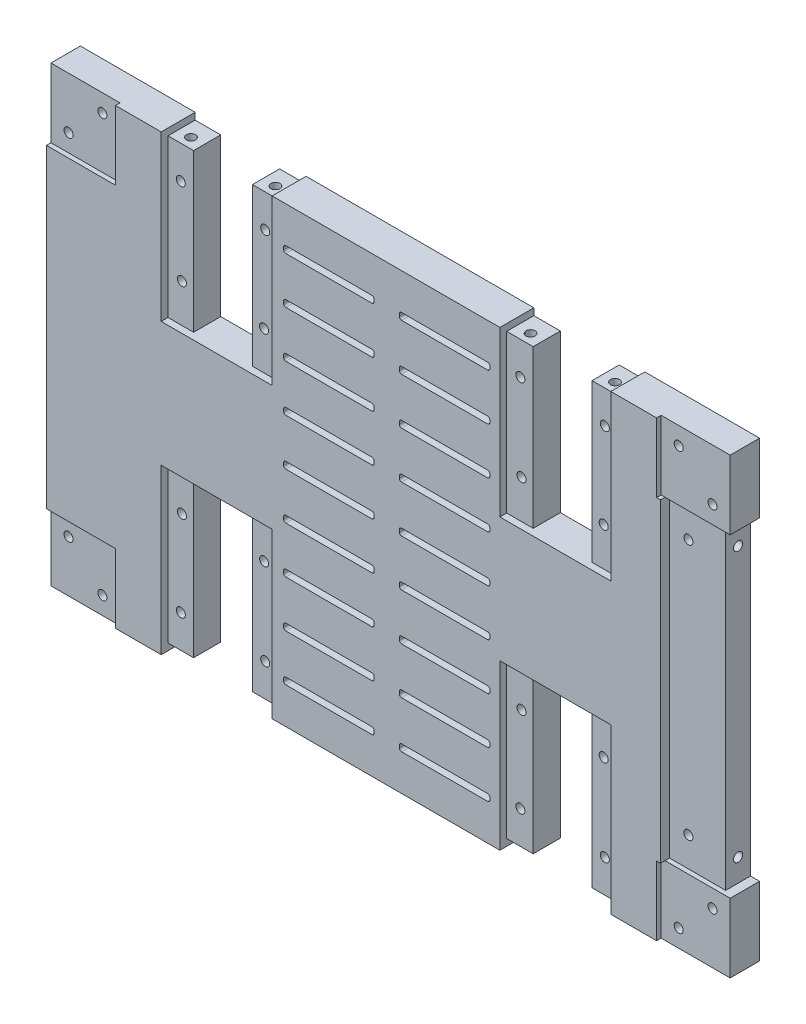
from build123d import *

# Parameters (mm, degrees)
CROQUIS1_W               = 300
CROQUIS1_H               = 200
SALIENTE_EXTRUIR1_DEPTH  = 15
CROQUIS2_W               = 30.5
CROQUIS2_H               = 30.5
HUECOS_COLUMNA_DEPTH     = 2
HUECOS_MOTOR_DEPTH       = 181.900525151
CROQUIS4_R               = 2
SIDE_SCREWS_1_DEPTH      = 15
SIDE_START               = -15
CROQUIS5_R               = 2
SIDE_SCREWS_2_DEPTH      = 15
CROQUIS7_R               = 2
SCREWS_AND_VENTI_DEPTH   = 15
CROQUIS9_W               = 49
CROQUIS9_H               = 69.5
CORTAR_EXTRUIR6_DEPTH    = 3
CROQUIS13_W              = 15
CROQUIS13_H              = 139
CORTAR_EXTRUIR9_DEPTH    = 4
CROQUIS14_W              = 24.78
CROQUIS14_H              = 139
CORTAR_EXTRUIR10_DEPTH   = 4
CROQUIS15_R              = 2
CORTAR_EXTRUIR11_DEPTH   = 4
CROQUIS16_R              = 2
SIDE_SCREWS_UPDOWN_DEPTH = 10


with BuildPart() as part:
    # Croquis1 → Saliente-Extruir1 (new body)
    with BuildSketch(Plane.XY):
        Rectangle(CROQUIS1_W, CROQUIS1_H)
    extrude(amount=SALIENTE_EXTRUIR1_DEPTH)

    # Croquis2 → Huecos columna (cut)
    with BuildSketch(Plane.XY.offset(15)):
        with Locations((-134.75, 84.75)):
            Rectangle(CROQUIS2_W, CROQUIS2_H)
        with Locations((134.75, 84.75)):
            Rectangle(CROQUIS2_W, CROQUIS2_H)
        with Locations((134.75, -84.75)):
            Rectangle(CROQUIS2_W, CROQUIS2_H)
        with Locations((-134.75, -84.75)):
            Rectangle(CROQUIS2_W, CROQUIS2_H)
    extrude(amount=-HUECOS_COLUMNA_DEPTH, mode=Mode.SUBTRACT)

    # Croquis3 → huecos motor (cut, through all)
    with BuildSketch(Plane.XY.offset(15)):
        Polygon((-88, -97), (-88, -27.5), (-62, -27.5), (-62, -97), (-50.295392228, -97), (-50.295392228, -100), (-99.295392228, -100), (-99.295392228, -97), align=None)
        Polygon((88, -27.5), (62, -27.5), (62, -97), (50.295392228, -97), (50.295392228, -100), (99.295392228, -100), (99.295392228, -97), (88, -97), align=None)
        Polygon((88, 97), (88, 27.5), (62, 27.5), (62, 97), (50.295392228, 97), (50.295392228, 100), (99.295392228, 100), (99.295392228, 97), align=None)
        Polygon((-88, 27.5), (-62, 27.5), (-62, 97), (-50.295392228, 97), (-50.295392228, 100), (-99.295392228, 100), (-99.295392228, 97), (-88, 97), align=None)
    extrude(amount=-HUECOS_MOTOR_DEPTH, mode=Mode.SUBTRACT)

    # Croquis4 → side_screws 1 (cut)
    with BuildSketch(Plane.XZ.offset(97)):
        with Locations((-93.647696114, 7.5)):
            Circle(CROQUIS4_R)
        with Locations((-56.352303886, 7.5)):
            Circle(CROQUIS4_R)
        with Locations((56.352303886, 7.5)):
            Circle(CROQUIS4_R)
        with Locations((93.647696114, 7.5)):
            Circle(CROQUIS4_R)
    extrude(amount=-SIDE_SCREWS_1_DEPTH, mode=Mode.SUBTRACT)

    # Croquis5 → side screws 2 (cut)
    with BuildSketch(Plane(origin=(0, 97, 0), x_dir=(1, 0, 0), z_dir=(0, 1, 0)).offset(SIDE_START)):
        with Locations((-93.647696114, -7.5)):
            Circle(CROQUIS5_R)
        with Locations((-56.352303886, -7.5)):
            Circle(CROQUIS5_R)
        with Locations((56.352303886, -7.5)):
            Circle(CROQUIS5_R)
        with Locations((93.647696114, -7.5)):
            Circle(CROQUIS5_R)
    extrude(amount=SIDE_SCREWS_2_DEPTH, mode=Mode.SUBTRACT)

    # Croquis7 → screws and venti (cut)
    with BuildSketch(Plane.XY.offset(15)):
        with Locations((-127.278174593, -92.221825407)):
            Circle(CROQUIS7_R)
        with Locations((-142.221825407, -77.278174593)):
            Circle(CROQUIS7_R)
        with Locations((-127.278174593, 92.221825407)):
            Circle(CROQUIS7_R)
        with Locations((-142.221825407, 77.278174593)):
            Circle(CROQUIS7_R)
        with Locations((127.278174593, -92.221825407)):
            Circle(CROQUIS7_R)
        with Locations((142.221825407, -77.278174593)):
            Circle(CROQUIS7_R)
        with Locations((127.278174593, 92.221825407)):
            Circle(CROQUIS7_R)
        with Locations((142.221825407, 77.278174593)):
            Circle(CROQUIS7_R)
        with Locations((-93.647696114, -82.5)):
            Circle(CROQUIS7_R)
        with Locations((-93.147733982, -44.503289118)):
            Circle(CROQUIS7_R)
        with Locations((-56.352303886, -82.5)):
            Circle(CROQUIS7_R)
        with Locations((-56.852266018, -44.503289118)):
            Circle(CROQUIS7_R)
        with Locations((56.852266018, -44.503289118)):
            Circle(CROQUIS7_R)
        with Locations((56.352303886, -82.5)):
            Circle(CROQUIS7_R)
        with Locations((93.647696114, -82.5)):
            Circle(CROQUIS7_R)
        with Locations((93.147733982, -44.503289118)):
            Circle(CROQUIS7_R)
        with Locations((93.647696114, 82.5)):
            Circle(CROQUIS7_R)
        with Locations((93.147733982, 44.503289118)):
            Circle(CROQUIS7_R)
        with Locations((56.352303886, 82.5)):
            Circle(CROQUIS7_R)
        with Locations((56.852266018, 44.503289118)):
            Circle(CROQUIS7_R)
        with Locations((-56.352303886, 82.5)):
            Circle(CROQUIS7_R)
        with Locations((-56.852266018, 44.503289118)):
            Circle(CROQUIS7_R)
        with Locations((-93.647696114, 82.5)):
            Circle(CROQUIS7_R)
        with Locations((-93.147733982, 44.503289118)):
            Circle(CROQUIS7_R)
        with BuildLine():
            Line((6.875948392, 84), (44.875948392, 84))
            ThreePointArc((44.875948392, 84), (45.583055173, 83.707106781), (45.875948392, 83))
            Line((45.875948392, 83), (45.875948392, 82))
            ThreePointArc((45.875948392, 82), (45.583055173, 81.292893219), (44.875948392, 81))
            Line((44.875948392, 81), (6.875948392, 81))
            ThreePointArc((6.875948392, 81), (6.168841611, 81.292893219), (5.875948392, 82))
            Line((5.875948392, 82), (5.875948392, 83))
            ThreePointArc((5.875948392, 83), (6.168841611, 83.707106781), (6.875948392, 84))
        make_face()
        with BuildLine():
            Line((-44.236036181, 81), (-6.236036181, 81))
            ThreePointArc((-6.236036181, 81), (-5.5289294, 81.292893219), (-5.236036181, 82))
            Line((-5.236036181, 82), (-5.236036181, 83))
            ThreePointArc((-5.236036181, 83), (-5.5289294, 83.707106781), (-6.236036181, 84))
            Line((-6.236036181, 84), (-44.236036181, 84))
            ThreePointArc((-44.236036181, 84), (-44.943142962, 83.707106781), (-45.236036181, 83))
            Line((-45.236036181, 83), (-45.236036181, 82))
            ThreePointArc((-45.236036181, 82), (-44.943142962, 81.292893219), (-44.236036181, 81))
        make_face()
        with BuildLine():
            Line((6.875948392, 63.375), (44.875948392, 63.375))
            ThreePointArc((44.875948392, 63.375), (45.583055173, 63.082106781), (45.875948392, 62.375))
            Line((45.875948392, 62.375), (45.875948392, 61.375))
            ThreePointArc((45.875948392, 61.375), (45.583055173, 60.667893219), (44.875948392, 60.375))
            Line((44.875948392, 60.375), (6.875948392, 60.375))
            ThreePointArc((6.875948392, 60.375), (6.168841611, 60.667893219), (5.875948392, 61.375))
            Line((5.875948392, 61.375), (5.875948392, 62.375))
            ThreePointArc((5.875948392, 62.375), (6.168841611, 63.082106781), (6.875948392, 63.375))
        make_face()
        with BuildLine():
            Line((6.875948392, 42.75), (44.875948392, 42.75))
            ThreePointArc((44.875948392, 42.75), (45.583055173, 42.457106781), (45.875948392, 41.75))
            Line((45.875948392, 41.75), (45.875948392, 40.75))
            ThreePointArc((45.875948392, 40.75), (45.583055173, 40.042893219), (44.875948392, 39.75))
            Line((44.875948392, 39.75), (6.875948392, 39.75))
            ThreePointArc((6.875948392, 39.75), (6.168841611, 40.042893219), (5.875948392, 40.75))
            Line((5.875948392, 40.75), (5.875948392, 41.75))
            ThreePointArc((5.875948392, 41.75), (6.168841611, 42.457106781), (6.875948392, 42.75))
        make_face()
        with BuildLine():
            Line((6.875948392, 22.125), (44.875948392, 22.125))
            ThreePointArc((44.875948392, 22.125), (45.583055173, 21.832106781), (45.875948392, 21.125))
            Line((45.875948392, 21.125), (45.875948392, 20.125))
            ThreePointArc((45.875948392, 20.125), (45.583055173, 19.417893219), (44.875948392, 19.125))
            Line((44.875948392, 19.125), (6.875948392, 19.125))
            ThreePointArc((6.875948392, 19.125), (6.168841611, 19.417893219), (5.875948392, 20.125))
            Line((5.875948392, 20.125), (5.875948392, 21.125))
            ThreePointArc((5.875948392, 21.125), (6.168841611, 21.832106781), (6.875948392, 22.125))
        make_face()
        with BuildLine():
            Line((6.875948392, 1.5), (44.875948392, 1.5))
            ThreePointArc((44.875948392, 1.5), (45.583055173, 1.207106781), (45.875948392, 0.5))
            Line((45.875948392, 0.5), (45.875948392, -0.5))
            ThreePointArc((45.875948392, -0.5), (45.583055173, -1.207106781), (44.875948392, -1.5))
            Line((44.875948392, -1.5), (6.875948392, -1.5))
            ThreePointArc((6.875948392, -1.5), (6.168841611, -1.207106781), (5.875948392, -0.5))
            Line((5.875948392, -0.5), (5.875948392, 0.5))
            ThreePointArc((5.875948392, 0.5), (6.168841611, 1.207106781), (6.875948392, 1.5))
        make_face()
        with BuildLine():
            Line((6.875948392, -19.125), (44.875948392, -19.125))
            ThreePointArc((44.875948392, -19.125), (45.583055173, -19.417893219), (45.875948392, -20.125))
            Line((45.875948392, -20.125), (45.875948392, -21.125))
            ThreePointArc((45.875948392, -21.125), (45.583055173, -21.832106781), (44.875948392, -22.125))
            Line((44.875948392, -22.125), (6.875948392, -22.125))
            ThreePointArc((6.875948392, -22.125), (6.168841611, -21.832106781), (5.875948392, -21.125))
            Line((5.875948392, -21.125), (5.875948392, -20.125))
            ThreePointArc((5.875948392, -20.125), (6.168841611, -19.417893219), (6.875948392, -19.125))
        make_face()
        with BuildLine():
            Line((6.875948392, -39.75), (44.875948392, -39.75))
            ThreePointArc((44.875948392, -39.75), (45.583055173, -40.042893219), (45.875948392, -40.75))
            Line((45.875948392, -40.75), (45.875948392, -41.75))
            ThreePointArc((45.875948392, -41.75), (45.583055173, -42.457106781), (44.875948392, -42.75))
            Line((44.875948392, -42.75), (6.875948392, -42.75))
            ThreePointArc((6.875948392, -42.75), (6.168841611, -42.457106781), (5.875948392, -41.75))
            Line((5.875948392, -41.75), (5.875948392, -40.75))
            ThreePointArc((5.875948392, -40.75), (6.168841611, -40.042893219), (6.875948392, -39.75))
        make_face()
        with BuildLine():
            Line((6.875948392, -60.375), (44.875948392, -60.375))
            ThreePointArc((44.875948392, -60.375), (45.583055173, -60.667893219), (45.875948392, -61.375))
            Line((45.875948392, -61.375), (45.875948392, -62.375))
            ThreePointArc((45.875948392, -62.375), (45.583055173, -63.082106781), (44.875948392, -63.375))
            Line((44.875948392, -63.375), (6.875948392, -63.375))
            ThreePointArc((6.875948392, -63.375), (6.168841611, -63.082106781), (5.875948392, -62.375))
            Line((5.875948392, -62.375), (5.875948392, -61.375))
            ThreePointArc((5.875948392, -61.375), (6.168841611, -60.667893219), (6.875948392, -60.375))
        make_face()
        with BuildLine():
            Line((6.875948392, -81), (44.875948392, -81))
            ThreePointArc((44.875948392, -81), (45.583055173, -81.292893219), (45.875948392, -82))
            Line((45.875948392, -82), (45.875948392, -83))
            ThreePointArc((45.875948392, -83), (45.583055173, -83.707106781), (44.875948392, -84))
            Line((44.875948392, -84), (6.875948392, -84))
            ThreePointArc((6.875948392, -84), (6.168841611, -83.707106781), (5.875948392, -83))
            Line((5.875948392, -83), (5.875948392, -82))
            ThreePointArc((5.875948392, -82), (6.168841611, -81.292893219), (6.875948392, -81))
        make_face()
        with BuildLine():
            Line((-44.236036181, 63.375), (-6.236036181, 63.375))
            ThreePointArc((-6.236036181, 63.375), (-5.5289294, 63.082106781), (-5.236036181, 62.375))
            Line((-5.236036181, 62.375), (-5.236036181, 61.375))
            ThreePointArc((-5.236036181, 61.375), (-5.5289294, 60.667893219), (-6.236036181, 60.375))
            Line((-6.236036181, 60.375), (-44.236036181, 60.375))
            ThreePointArc((-44.236036181, 60.375), (-44.943142962, 60.667893219), (-45.236036181, 61.375))
            Line((-45.236036181, 61.375), (-45.236036181, 62.375))
            ThreePointArc((-45.236036181, 62.375), (-44.943142962, 63.082106781), (-44.236036181, 63.375))
        make_face()
        with BuildLine():
            Line((-44.236036181, 42.75), (-6.236036181, 42.75))
            ThreePointArc((-6.236036181, 42.75), (-5.5289294, 42.457106781), (-5.236036181, 41.75))
            Line((-5.236036181, 41.75), (-5.236036181, 40.75))
            ThreePointArc((-5.236036181, 40.75), (-5.5289294, 40.042893219), (-6.236036181, 39.75))
            Line((-6.236036181, 39.75), (-44.236036181, 39.75))
            ThreePointArc((-44.236036181, 39.75), (-44.943142962, 40.042893219), (-45.236036181, 40.75))
            Line((-45.236036181, 40.75), (-45.236036181, 41.75))
            ThreePointArc((-45.236036181, 41.75), (-44.943142962, 42.457106781), (-44.236036181, 42.75))
        make_face()
        with BuildLine():
            Line((-44.236036181, 22.125), (-6.236036181, 22.125))
            ThreePointArc((-6.236036181, 22.125), (-5.5289294, 21.832106781), (-5.236036181, 21.125))
            Line((-5.236036181, 21.125), (-5.236036181, 20.125))
            ThreePointArc((-5.236036181, 20.125), (-5.5289294, 19.417893219), (-6.236036181, 19.125))
            Line((-6.236036181, 19.125), (-44.236036181, 19.125))
            ThreePointArc((-44.236036181, 19.125), (-44.943142962, 19.417893219), (-45.236036181, 20.125))
            Line((-45.236036181, 20.125), (-45.236036181, 21.125))
            ThreePointArc((-45.236036181, 21.125), (-44.943142962, 21.832106781), (-44.236036181, 22.125))
        make_face()
        with BuildLine():
            Line((-44.236036181, 1.5), (-6.236036181, 1.5))
            ThreePointArc((-6.236036181, 1.5), (-5.5289294, 1.207106781), (-5.236036181, 0.5))
            Line((-5.236036181, 0.5), (-5.236036181, -0.5))
            ThreePointArc((-5.236036181, -0.5), (-5.5289294, -1.207106781), (-6.236036181, -1.5))
            Line((-6.236036181, -1.5), (-44.236036181, -1.5))
            ThreePointArc((-44.236036181, -1.5), (-44.943142962, -1.207106781), (-45.236036181, -0.5))
            Line((-45.236036181, -0.5), (-45.236036181, 0.5))
            ThreePointArc((-45.236036181, 0.5), (-44.943142962, 1.207106781), (-44.236036181, 1.5))
        make_face()
        with BuildLine():
            Line((-44.236036181, -19.125), (-6.236036181, -19.125))
            ThreePointArc((-6.236036181, -19.125), (-5.5289294, -19.417893219), (-5.236036181, -20.125))
            Line((-5.236036181, -20.125), (-5.236036181, -21.125))
            ThreePointArc((-5.236036181, -21.125), (-5.5289294, -21.832106781), (-6.236036181, -22.125))
            Line((-6.236036181, -22.125), (-44.236036181, -22.125))
            ThreePointArc((-44.236036181, -22.125), (-44.943142962, -21.832106781), (-45.236036181, -21.125))
            Line((-45.236036181, -21.125), (-45.236036181, -20.125))
            ThreePointArc((-45.236036181, -20.125), (-44.943142962, -19.417893219), (-44.236036181, -19.125))
        make_face()
        with BuildLine():
            Line((-44.236036181, -39.75), (-6.236036181, -39.75))
            ThreePointArc((-6.236036181, -39.75), (-5.5289294, -40.042893219), (-5.236036181, -40.75))
            Line((-5.236036181, -40.75), (-5.236036181, -41.75))
            ThreePointArc((-5.236036181, -41.75), (-5.5289294, -42.457106781), (-6.236036181, -42.75))
            Line((-6.236036181, -42.75), (-44.236036181, -42.75))
            ThreePointArc((-44.236036181, -42.75), (-44.943142962, -42.457106781), (-45.236036181, -41.75))
            Line((-45.236036181, -41.75), (-45.236036181, -40.75))
            ThreePointArc((-45.236036181, -40.75), (-44.943142962, -40.042893219), (-44.236036181, -39.75))
        make_face()
        with BuildLine():
            Line((-44.236036181, -60.375), (-6.236036181, -60.375))
            ThreePointArc((-6.236036181, -60.375), (-5.5289294, -60.667893219), (-5.236036181, -61.375))
            Line((-5.236036181, -61.375), (-5.236036181, -62.375))
            ThreePointArc((-5.236036181, -62.375), (-5.5289294, -63.082106781), (-6.236036181, -63.375))
            Line((-6.236036181, -63.375), (-44.236036181, -63.375))
            ThreePointArc((-44.236036181, -63.375), (-44.943142962, -63.082106781), (-45.236036181, -62.375))
            Line((-45.236036181, -62.375), (-45.236036181, -61.375))
            ThreePointArc((-45.236036181, -61.375), (-44.943142962, -60.667893219), (-44.236036181, -60.375))
        make_face()
        with BuildLine():
            Line((-44.236036181, -81), (-6.236036181, -81))
            ThreePointArc((-6.236036181, -81), (-5.5289294, -81.292893219), (-5.236036181, -82))
            Line((-5.236036181, -82), (-5.236036181, -83))
            ThreePointArc((-5.236036181, -83), (-5.5289294, -83.707106781), (-6.236036181, -84))
            Line((-6.236036181, -84), (-44.236036181, -84))
            ThreePointArc((-44.236036181, -84), (-44.943142962, -83.707106781), (-45.236036181, -83))
            Line((-45.236036181, -83), (-45.236036181, -82))
            ThreePointArc((-45.236036181, -82), (-44.943142962, -81.292893219), (-44.236036181, -81))
        make_face()
    extrude(amount=-SCREWS_AND_VENTI_DEPTH, mode=Mode.SUBTRACT)

    # Croquis9 → Cortar-Extruir6 (cut)
    with BuildSketch(Plane.XY.offset(15)):
        with Locations((-74.795392228, -62.25)):
            Rectangle(CROQUIS9_W, CROQUIS9_H)
        with Locations((74.795392228, -62.25)):
            Rectangle(CROQUIS9_W, CROQUIS9_H)
        with Locations((74.795392228, 62.25)):
            Rectangle(CROQUIS9_W, CROQUIS9_H)
        with Locations((-74.795392228, 62.25)):
            Rectangle(CROQUIS9_W, CROQUIS9_H)
    extrude(amount=-CORTAR_EXTRUIR6_DEPTH, mode=Mode.SUBTRACT)

    # Croquis13 → Cortar-Extruir9 (cut)
    with BuildSketch(Plane(origin=(150, 0, 0), x_dir=(0, 0, -1), z_dir=(1, 0, 0))):
        with Locations((-7.5, 0)):
            Rectangle(CROQUIS13_W, CROQUIS13_H)
    extrude(amount=-CORTAR_EXTRUIR9_DEPTH, mode=Mode.SUBTRACT)

    # Croquis14 → Cortar-Extruir10 (cut)
    with BuildSketch(Plane.XY.offset(15)):
        with Locations((133.61, 0)):
            Rectangle(CROQUIS14_W, CROQUIS14_H)
    extrude(amount=-CORTAR_EXTRUIR10_DEPTH, mode=Mode.SUBTRACT)

    # Croquis15 → Cortar-Extruir11 (cut)
    with BuildSketch(Plane.XY.offset(11)):
        with Locations((129.59, 56.5)):
            Circle(CROQUIS15_R)
        with Locations((129.59, -56.5)):
            Circle(CROQUIS15_R)
    extrude(amount=-CORTAR_EXTRUIR11_DEPTH, mode=Mode.SUBTRACT)

    # Croquis16 → side screws - updown (cut)
    with BuildSketch(Plane(origin=(146, 0, 0), x_dir=(0, 0, -1), z_dir=(1, 0, 0))):
        with Locations((-5.5, 59.5)):
            Circle(CROQUIS16_R)
        with Locations((-5.5, -59.5)):
            Circle(CROQUIS16_R)
    extrude(amount=-SIDE_SCREWS_UPDOWN_DEPTH, mode=Mode.SUBTRACT)


solid = part.part
